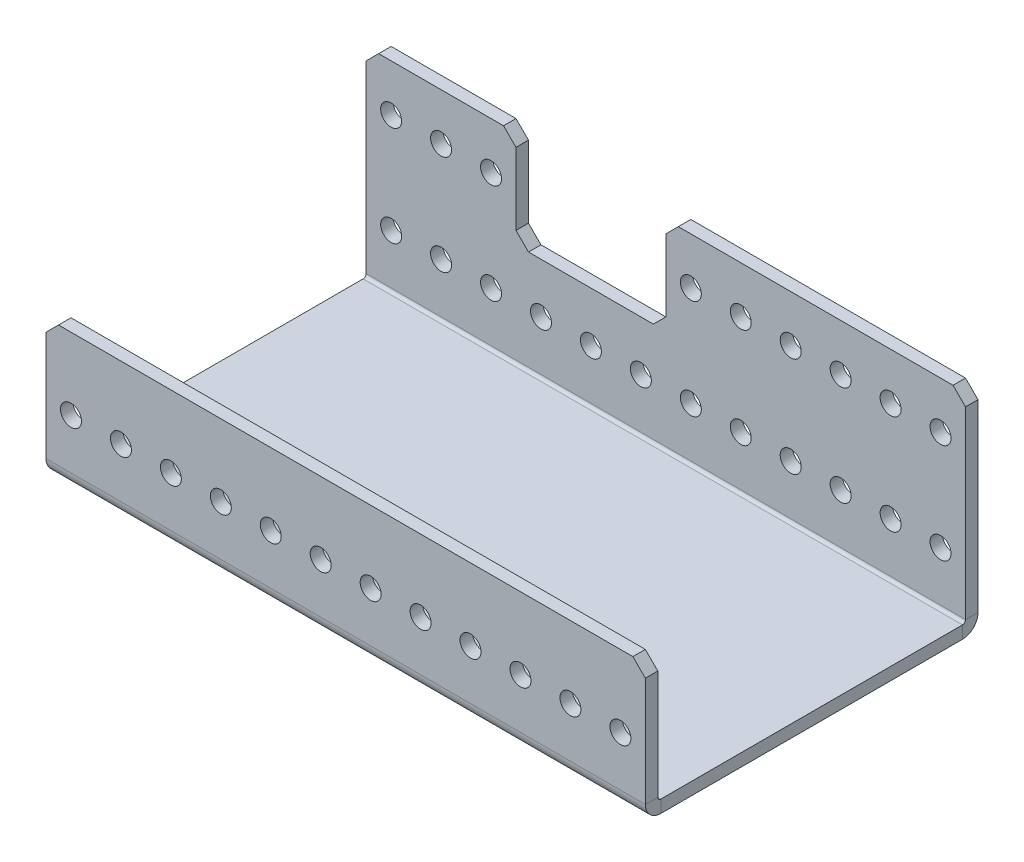
from build123d import *

# Parameters (mm, degrees)
CUT_EXTRUDE1_START       = -81.407
CUT_EXTRUDE1_OUTLINE_W   = 152.4
CUT_EXTRUDE1_OUTLINE_H   = 3.175
CUT_EXTRUDE1_DEPTH       = 84.582
CUT_EXTRUDE1_2_OUTLINE_R = 2.667
CUT_EXTRUDE1_2_DEPTH     = 3.175
CUT_EXTRUDE1_START_2     = -0.762
CUT_EXTRUDE1_3_OUTLINE_R = 2.667
CUT_EXTRUDE1_3_DEPTH     = 3.937
CUT_EXTRUDE1_START_3     = -78.232
CUT_EXTRUDE1_4_OUTLINE_R = 2.667
CUT_EXTRUDE1_4_DEPTH     = 0.762
CUT_EXTRUDE1_START_4     = 635
CUT_EXTRUDE1_5_DEPTH     = 152.4
CHAMFER1_SIZE            = 3.175
SKETCH2_W                = 38.1
SKETCH2_H                = 24.638
SKETCH2_R                = 2.667
CUT_EXTRUDE2_DEPTH       = 3.175
CHAMFER2_SIZE            = 3.175
CHAMFER3_SIZE            = 3.175


with BuildPart() as part:
    # Cut-Extrude1: read off the stored shape, not the designer's step
    # Cut-Extrude1 outline → Cut-Extrude1 (new body)
    with BuildSketch(Plane.XY.offset(CUT_EXTRUDE1_START)):
        with Locations((711.2, 1.5875)):
            Rectangle(CUT_EXTRUDE1_OUTLINE_W, CUT_EXTRUDE1_OUTLINE_H)
    extrude(amount=CUT_EXTRUDE1_DEPTH)

    # Cut-Extrude1 2 outline → Cut-Extrude1 2 (add)
    with BuildSketch(Plane.XY.offset(CUT_EXTRUDE1_START)):
        Polygon((635, 3.175), (787.4, 3.175), (787.4, 50.8), (784.225, 53.975), (635, 53.975), align=None)
        with Locations((641.35, 16.637)):
            Circle(CUT_EXTRUDE1_2_OUTLINE_R, mode=Mode.SUBTRACT)
        with Locations((654.05, 16.637)):
            Circle(CUT_EXTRUDE1_2_OUTLINE_R, mode=Mode.SUBTRACT)
        with Locations((666.75, 16.637)):
            Circle(CUT_EXTRUDE1_2_OUTLINE_R, mode=Mode.SUBTRACT)
        with Locations((679.45, 16.637)):
            Circle(CUT_EXTRUDE1_2_OUTLINE_R, mode=Mode.SUBTRACT)
        with Locations((692.15, 16.637)):
            Circle(CUT_EXTRUDE1_2_OUTLINE_R, mode=Mode.SUBTRACT)
        with Locations((704.85, 16.637)):
            Circle(CUT_EXTRUDE1_2_OUTLINE_R, mode=Mode.SUBTRACT)
        with Locations((717.55, 16.637)):
            Circle(CUT_EXTRUDE1_2_OUTLINE_R, mode=Mode.SUBTRACT)
        with Locations((730.25, 16.637)):
            Circle(CUT_EXTRUDE1_2_OUTLINE_R, mode=Mode.SUBTRACT)
        with Locations((742.95, 16.637)):
            Circle(CUT_EXTRUDE1_2_OUTLINE_R, mode=Mode.SUBTRACT)
        with Locations((755.65, 16.637)):
            Circle(CUT_EXTRUDE1_2_OUTLINE_R, mode=Mode.SUBTRACT)
        with Locations((768.35, 16.637)):
            Circle(CUT_EXTRUDE1_2_OUTLINE_R, mode=Mode.SUBTRACT)
        with Locations((781.05, 16.637)):
            Circle(CUT_EXTRUDE1_2_OUTLINE_R, mode=Mode.SUBTRACT)
        with Locations((768.35, 42.037)):
            Circle(CUT_EXTRUDE1_2_OUTLINE_R, mode=Mode.SUBTRACT)
        with Locations((781.05, 42.037)):
            Circle(CUT_EXTRUDE1_2_OUTLINE_R, mode=Mode.SUBTRACT)
        with Locations((641.35, 42.037)):
            Circle(CUT_EXTRUDE1_2_OUTLINE_R, mode=Mode.SUBTRACT)
        with Locations((654.05, 42.037)):
            Circle(CUT_EXTRUDE1_2_OUTLINE_R, mode=Mode.SUBTRACT)
        with Locations((666.75, 42.037)):
            Circle(CUT_EXTRUDE1_2_OUTLINE_R, mode=Mode.SUBTRACT)
        with Locations((679.45, 42.037)):
            Circle(CUT_EXTRUDE1_2_OUTLINE_R, mode=Mode.SUBTRACT)
        with Locations((692.15, 42.037)):
            Circle(CUT_EXTRUDE1_2_OUTLINE_R, mode=Mode.SUBTRACT)
        with Locations((704.85, 42.037)):
            Circle(CUT_EXTRUDE1_2_OUTLINE_R, mode=Mode.SUBTRACT)
        with Locations((717.55, 42.037)):
            Circle(CUT_EXTRUDE1_2_OUTLINE_R, mode=Mode.SUBTRACT)
        with Locations((730.25, 42.037)):
            Circle(CUT_EXTRUDE1_2_OUTLINE_R, mode=Mode.SUBTRACT)
        with Locations((742.95, 42.037)):
            Circle(CUT_EXTRUDE1_2_OUTLINE_R, mode=Mode.SUBTRACT)
        with Locations((755.65, 42.037)):
            Circle(CUT_EXTRUDE1_2_OUTLINE_R, mode=Mode.SUBTRACT)
    extrude(amount=CUT_EXTRUDE1_2_DEPTH)

    # Cut-Extrude1 3 outline → Cut-Extrude1 3 (add)
    with BuildSketch(Plane.XY.offset(CUT_EXTRUDE1_START_2)):
        Polygon((635, 34.925), (635, 3.175), (787.4, 3.175), (787.4, 31.75), (784.225, 34.925), align=None)
        with Locations((641.35, 16.637)):
            Circle(CUT_EXTRUDE1_3_OUTLINE_R, mode=Mode.SUBTRACT)
        with Locations((654.05, 16.637)):
            Circle(CUT_EXTRUDE1_3_OUTLINE_R, mode=Mode.SUBTRACT)
        with Locations((666.75, 16.637)):
            Circle(CUT_EXTRUDE1_3_OUTLINE_R, mode=Mode.SUBTRACT)
        with Locations((679.45, 16.637)):
            Circle(CUT_EXTRUDE1_3_OUTLINE_R, mode=Mode.SUBTRACT)
        with Locations((692.15, 16.637)):
            Circle(CUT_EXTRUDE1_3_OUTLINE_R, mode=Mode.SUBTRACT)
        with Locations((704.85, 16.637)):
            Circle(CUT_EXTRUDE1_3_OUTLINE_R, mode=Mode.SUBTRACT)
        with Locations((717.55, 16.637)):
            Circle(CUT_EXTRUDE1_3_OUTLINE_R, mode=Mode.SUBTRACT)
        with Locations((730.25, 16.637)):
            Circle(CUT_EXTRUDE1_3_OUTLINE_R, mode=Mode.SUBTRACT)
        with Locations((742.95, 16.637)):
            Circle(CUT_EXTRUDE1_3_OUTLINE_R, mode=Mode.SUBTRACT)
        with Locations((755.65, 16.637)):
            Circle(CUT_EXTRUDE1_3_OUTLINE_R, mode=Mode.SUBTRACT)
        with Locations((768.35, 16.637)):
            Circle(CUT_EXTRUDE1_3_OUTLINE_R, mode=Mode.SUBTRACT)
        with Locations((781.05, 16.637)):
            Circle(CUT_EXTRUDE1_3_OUTLINE_R, mode=Mode.SUBTRACT)
    extrude(amount=CUT_EXTRUDE1_3_DEPTH)

    # Cut-Extrude1 4 outline → Cut-Extrude1 4 (add)
    with BuildSketch(Plane.XY.offset(CUT_EXTRUDE1_START_3)):
        Polygon((635, 34.925), (635, 3.175), (787.4, 3.175), (787.4, 31.75), (784.225, 34.925), align=None)
        with Locations((641.35, 16.637)):
            Circle(CUT_EXTRUDE1_4_OUTLINE_R, mode=Mode.SUBTRACT)
        with Locations((654.05, 16.637)):
            Circle(CUT_EXTRUDE1_4_OUTLINE_R, mode=Mode.SUBTRACT)
        with Locations((666.75, 16.637)):
            Circle(CUT_EXTRUDE1_4_OUTLINE_R, mode=Mode.SUBTRACT)
        with Locations((679.45, 16.637)):
            Circle(CUT_EXTRUDE1_4_OUTLINE_R, mode=Mode.SUBTRACT)
        with Locations((692.15, 16.637)):
            Circle(CUT_EXTRUDE1_4_OUTLINE_R, mode=Mode.SUBTRACT)
        with Locations((704.85, 16.637)):
            Circle(CUT_EXTRUDE1_4_OUTLINE_R, mode=Mode.SUBTRACT)
        with Locations((717.55, 16.637)):
            Circle(CUT_EXTRUDE1_4_OUTLINE_R, mode=Mode.SUBTRACT)
        with Locations((730.25, 16.637)):
            Circle(CUT_EXTRUDE1_4_OUTLINE_R, mode=Mode.SUBTRACT)
        with Locations((742.95, 16.637)):
            Circle(CUT_EXTRUDE1_4_OUTLINE_R, mode=Mode.SUBTRACT)
        with Locations((755.65, 16.637)):
            Circle(CUT_EXTRUDE1_4_OUTLINE_R, mode=Mode.SUBTRACT)
        with Locations((768.35, 16.637)):
            Circle(CUT_EXTRUDE1_4_OUTLINE_R, mode=Mode.SUBTRACT)
        with Locations((781.05, 16.637)):
            Circle(CUT_EXTRUDE1_4_OUTLINE_R, mode=Mode.SUBTRACT)
    extrude(amount=CUT_EXTRUDE1_4_DEPTH)

    # Cut-Extrude1 5 outline → Cut-Extrude1 5 (cut)
    with BuildSketch(Plane.YZ.offset(CUT_EXTRUDE1_START_4)):
        with BuildLine():
            Line((0, -81.407), (3.937, -81.407))
            ThreePointArc((3.937, -81.407), (1.153120602, -80.253879398), (0, -77.47))
            Line((0, -77.47), (0, -81.407))
        make_face()
        with BuildLine():
            Line((34.925, -0.762), (34.925, 0))
            Line((34.925, 0), (3.937, 0))
            ThreePointArc((3.937, 0), (3.398184633, -0.223184633), (3.175, -0.762))
            Line((3.175, -0.762), (34.925, -0.762))
        make_face()
        with BuildLine():
            Line((0, 3.175), (0, -0.762))
            ThreePointArc((0, -0.762), (1.153120602, 2.021879398), (3.937, 3.175))
            Line((3.937, 3.175), (0, 3.175))
        make_face()
        with BuildLine():
            ThreePointArc((3.175, -77.47), (3.398184633, -78.008815367), (3.937, -78.232))
            Line((3.937, -78.232), (34.925, -78.232))
            Line((34.925, -78.232), (34.925, -77.47))
            Line((34.925, -77.47), (3.175, -77.47))
        make_face()
    extrude(amount=CUT_EXTRUDE1_5_DEPTH, mode=Mode.SUBTRACT)

    # Chamfer1
    chamfer1_edges = [part.edges().sort_by_distance(p)[0] for p in [
        (635, 34.925, 1.5875),
        (635, 53.975, -79.8195),
    ]]
    chamfer(chamfer1_edges, length=CHAMFER1_SIZE)

    # Sketch2 → Cut-Extrude2 (cut)
    with BuildSketch(Plane(origin=(0, 0, -81.407), x_dir=(-1, 0, 0), z_dir=(0, 0, -1))):
        with Locations((-692.15, 41.656)):
            Rectangle(SKETCH2_W, SKETCH2_H)
        with Locations((-704.85, 42.037)):
            Circle(SKETCH2_R, mode=Mode.SUBTRACT)
        with Locations((-692.15, 42.037)):
            Circle(SKETCH2_R, mode=Mode.SUBTRACT)
        with Locations((-679.45, 42.037)):
            Circle(SKETCH2_R, mode=Mode.SUBTRACT)
    extrude(amount=-CUT_EXTRUDE2_DEPTH, mode=Mode.SUBTRACT)

    # Chamfer2
    chamfer2_edges = [part.edges().sort_by_distance(p)[0] for p in [
        (711.2, 53.975, -79.8195),
        (673.1, 53.975, -79.8195),
    ]]
    chamfer(chamfer2_edges, length=CHAMFER2_SIZE)

    # Chamfer3
    chamfer3_edges = [part.edges().sort_by_distance(p)[0] for p in [
        (711.2, 29.337, -79.8195),
        (673.1, 29.337, -79.8195),
    ]]
    chamfer(chamfer3_edges, length=CHAMFER3_SIZE)


solid = part.part
